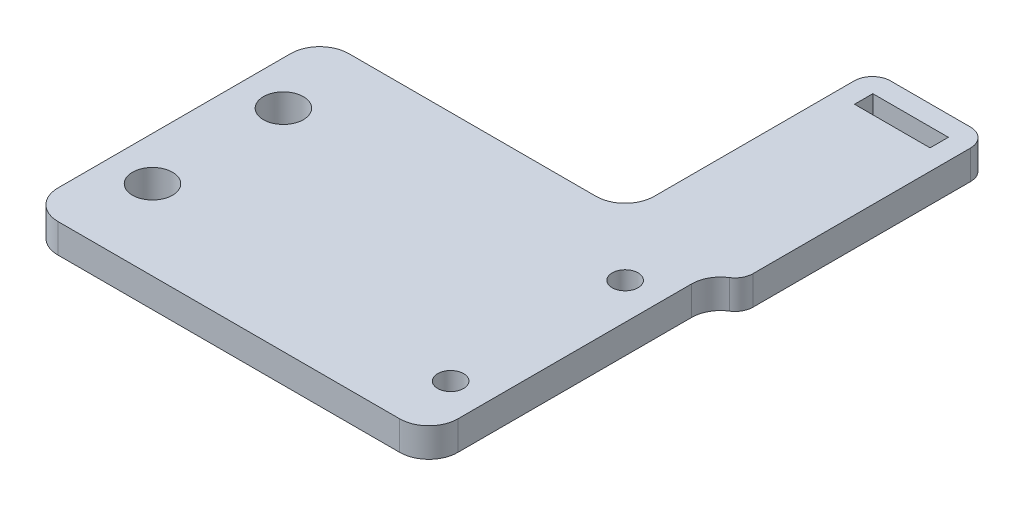
from build123d import *

# Parameters (mm, degrees)
SKETCH1_W               = 34.925
SKETCH1_H               = 25.4
BOSS_EXTRUDE1_DEPTH     = 2.54
CUT_EXTRUDE3_DEPTH      = 44.259302179
CUT_EXTRUDE3_DEPTH_BACK = 44.259302179
SKETCH2_R               = 1.74625
SKETCH5_R               = 1.1303
CUT_EXTRUDE4_DEPTH      = 44.259302179
SKETCH6_W               = 10.16
SKETCH6_H               = 21.59
BOSS_EXTRUDE2_DEPTH     = 2.54
FILLET1_R               = 2.54
FILLET2_R               = 1.5875
FILLET3_R               = 2.54
SKETCH8_W               = 6.597299276
SKETCH8_H               = 1.6002
CUT_EXTRUDE6_DEPTH      = 2.54


with BuildPart() as part:
    # Sketch1 → Boss-Extrude1 (new body)
    with BuildSketch(Plane(origin=(0, 0, 0), x_dir=(1, 0, 0), z_dir=(0, 1, 0))):
        with Locations((17.4625, 12.7)):
            Rectangle(SKETCH1_W, SKETCH1_H)
    extrude(amount=BOSS_EXTRUDE1_DEPTH)

    # Sketch2 → Cut-Extrude3 (cut, two sides: drawn at the far end of the back side and taken through both)
    with BuildSketch(Plane(origin=(0, 2.54, 0), x_dir=(1, 0, 0), z_dir=(0, 1, 0)).offset(-CUT_EXTRUDE3_DEPTH_BACK)):
        with Locations(Location((3.81, 18.415, 0), (0, 0, 90))):
            Circle(SKETCH2_R)
        with Locations(Location((3.81, 6.985, 0), (0, 0, 90))):
            Circle(SKETCH2_R)
    extrude(amount=CUT_EXTRUDE3_DEPTH + CUT_EXTRUDE3_DEPTH_BACK, mode=Mode.SUBTRACT)

    # Sketch5 → Cut-Extrude4 (cut, through all)
    with BuildSketch(Plane(origin=(0, 2.54, 0), x_dir=(1, 0, 0), z_dir=(0, 1, 0))):
        with Locations(Location((31.75, 20.32, 0), (0, 0, 270))):
            Circle(SKETCH5_R)
        with Locations(Location((31.75, 5.08, 0), (0, 0, 90))):
            Circle(SKETCH5_R)
    extrude(amount=-CUT_EXTRUDE4_DEPTH, mode=Mode.SUBTRACT)

    # Sketch6 → Boss-Extrude2 (add)
    with BuildSketch(Plane(origin=(0, 2.54, 0), x_dir=(1, 0, 0), z_dir=(0, 1, 0))):
        with Locations((31.75, 36.195)):
            Rectangle(SKETCH6_W, SKETCH6_H)
    extrude(amount=-BOSS_EXTRUDE2_DEPTH)

    # Fillet1
    # the kernel refuses this fillet: 2.54 mm, written as the material it adds along each edge
    with BuildSketch(Plane(origin=(26.67, 2.54, -25.4), x_dir=(-1, 0, 0), z_dir=(0, -1, 0))) as fillet1_piece_1:
        with BuildLine():
            CenterArc((FILLET1_R, FILLET1_R), FILLET1_R, 180, 90)
            Line((0, FILLET1_R), (-FILLET1_R * 0.02, FILLET1_R))
            Line((-FILLET1_R * 0.02, FILLET1_R), (-FILLET1_R * 0.02, -FILLET1_R * 0.02))
            Line((-FILLET1_R * 0.02, -FILLET1_R * 0.02), (FILLET1_R, -FILLET1_R * 0.02))
            Line((FILLET1_R, -FILLET1_R * 0.02), (FILLET1_R, 0))
        make_face()
    extrude(amount=2.54)
    with BuildSketch(Plane(origin=(34.925, 0, -25.4), x_dir=(0, 0, 1), z_dir=(0, 1, 0))) as fillet1_piece_2:
        with BuildLine():
            CenterArc((2.459344425, 2.54), FILLET1_R, 194.477512186, 75.522487814)
            Line((0, 1.905), (-0.049186888, 1.8923))
            ThreePointArc((-0.049186888, 1.8923), (-0.0508, 0.9525), (-0.0508, 0))
            Line((-0.0508, 0), (0, -0.0508))
            Line((0, -0.0508), (2.459344425, -0.0508))
            Line((2.459344425, -0.0508), (2.459344425, 0))
        make_face()
    extrude(amount=2.54)

    # Fillet2
    fillet2_edges = [part.edges().sort_by_distance(p)[0] for p in [
        (26.67, 1.27, -46.99),
        (36.83, 1.27, -46.99),
        (36.83, 1.27, -25.4),
    ]]
    fillet(fillet2_edges, radius=FILLET2_R)

    # Fillet3
    fillet3_edges = [part.edges().sort_by_distance(p)[0] for p in [
        (0, 1.27, -25.4),
        (34.925, 1.27, 0),
        (0, 1.27, 0),
    ]]
    fillet(fillet3_edges, radius=FILLET3_R)

    # Sketch8 → Cut-Extrude6 (cut)
    with BuildSketch(Plane(origin=(0, 2.54, 0), x_dir=(1, 0, 0), z_dir=(0, 1, 0))):
        with Locations((31.75, 44.45)):
            Rectangle(SKETCH8_W, SKETCH8_H)
    extrude(amount=-CUT_EXTRUDE6_DEPTH, mode=Mode.SUBTRACT)


solid = part.part
